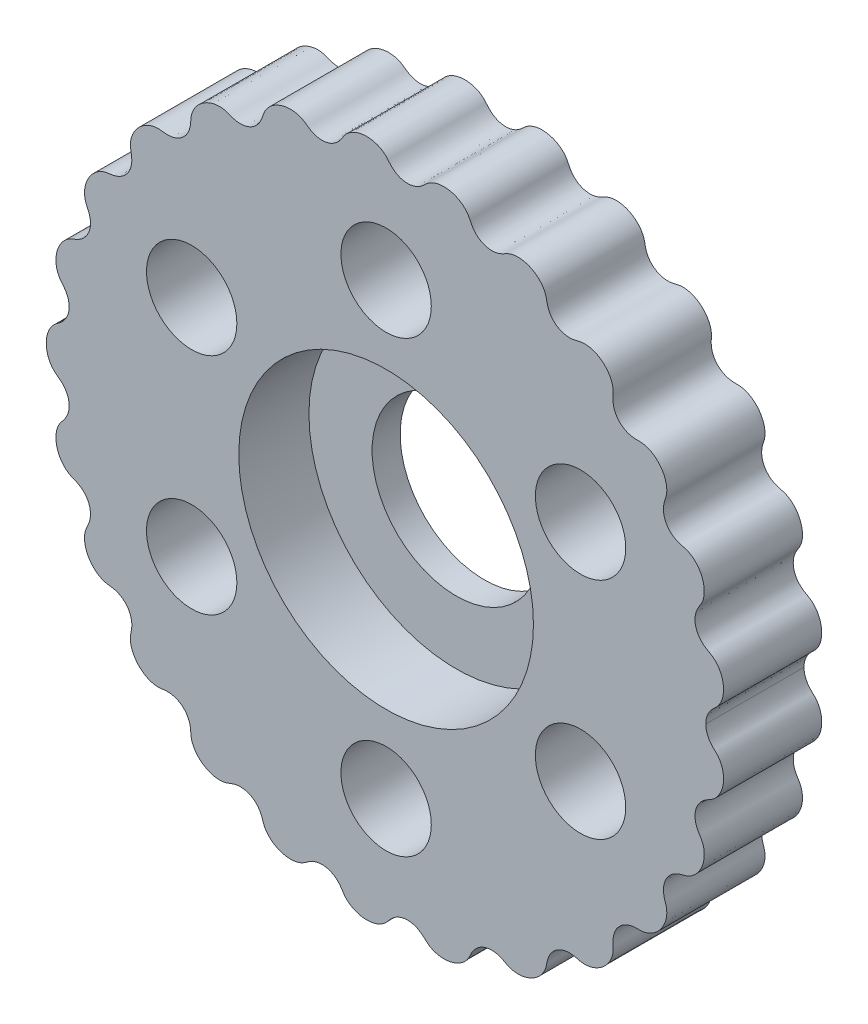
from build123d import *

# Parameters (mm, degrees)
BOSS_EXTRUDE2_OUTLINE_R   = 3.22
BOSS_EXTRUDE2_OUTLINE_R_2 = 6
BOSS_EXTRUDE2_DEPTH       = 7
SKETCH3_R                 = 10.5
CUT_EXTRUDE1_DEPTH        = 5


# Read off the part's stored shape, not the designer's step: Boss-Extrude2
with BuildPart() as part:
    # Boss-Extrude2 outline → Boss-Extrude2 (new body)
    with BuildSketch(Plane.XY):
        with BuildLine():
            add(Edge.make_bspline(
                [(-24.22, 0), (-24.22, -0.018549196), (-24.219447299, -0.055631093), (-24.216960054, -0.12081441), (-24.210325897, -0.213487932), (-24.197882321, -0.323999799), (-24.176299834, -0.448982193), (-24.141395786, -0.595895603), (-24.088097077, -0.760122302), (-24.021284653, -0.918911553), (-23.94083921, -1.071476253), (-23.850156372, -1.210449232), (-23.750782771, -1.335175792), (-23.644418658, -1.445156499), (-23.532877519, -1.540026346), (-23.414565779, -1.626138769), (-23.295742191, -1.711436542), (-23.152646986, -1.82541348), (-22.967845238, -2.00358463), (-22.770766979, -2.270831102), (-22.61467742, -2.646713727), (-22.562902109, -3.087016939), (-22.626971537, -3.487565417), (-22.754815757, -3.791453025), (-22.891097081, -4.006933416), (-23.001901076, -4.151043768), (-23.095543837, -4.262219923), (-23.187445569, -4.374975056), (-23.269946813, -4.494784084), (-23.406247867, -4.740164684), (-23.53300629, -5.139768536), (-23.561700117, -5.698191268), (-23.386758438, -6.370571851), (-23.08963931, -6.844663095), (-22.783232826, -7.131342999), (-22.513168869, -7.298248762), (-22.313162523, -7.386218135), (-22.073134472, -7.471500821), (-21.778048031, -7.628259898), (-21.485035026, -7.865958292), (-21.237485622, -8.200285268), (-21.080759868, -8.62358006), (-21.049802486, -9.030968373), (-21.10243357, -9.354111964), (-21.183212319, -9.594182109), (-21.255573883, -9.75945739), (-21.318445407, -9.889381057), (-21.377949252, -10.020968458), (-21.426108106, -10.157164339), (-21.493710602, -10.427539308), (-21.513763193, -10.843420478), (-21.399915455, -11.390295219), (-21.102267605, -11.921886845), (-20.739385996, -12.297765819), (-20.415144238, -12.507692145), (-20.187923445, -12.608393522), (-19.997598517, -12.663680464), (-19.851881049, -12.690844938), (-19.704782383, -12.708389621), (-19.557874768, -12.727166257), (-19.375798661, -12.761217219), (-19.12514698, -12.834376848), (-18.821392565, -12.983928801), (-18.504883804, -13.253142477), (-18.255677763, -13.631335911), (-18.133312589, -14.023313646), (-18.110968987, -14.38890418), (-18.150097941, -14.710357198), (-18.216222015, -14.985193283), (-18.236712715, -15.281724635), (-18.197714574, -15.589639034), (-18.079407169, -15.979423518), (-17.869747332, -16.35091051), (-17.588251709, -16.675151517), (-17.245174502, -16.936765712), (-16.93557318, -17.10184519), (-16.649505418, -17.195443205), (-16.402439494, -17.234569713), (-16.203020578, -17.238662266), (-16.054339482, -17.227081449), (-15.906658236, -17.206886615), (-15.75867165, -17.189257805), (-15.572570565, -17.178637046), (-15.309989239, -17.1903718), (-14.977339407, -17.264917246), (-14.609384419, -17.451766877), (-14.284470124, -17.754814286), (-14.075231513, -18.097537161), (-13.964820751, -18.437303989), (-13.921748971, -18.754956982), (-13.917697603, -19.039689384), (-13.864404565, -19.334240426), (-13.749434711, -19.624864832), (-13.536523355, -19.975209385), (-13.240132232, -20.282910695), (-12.88771773, -20.525640252), (-12.493535044, -20.692228457), (-12.158712678, -20.774525308), (-11.862323107, -20.795520407), (-11.614686672, -20.774204172), (-11.419415062, -20.730290527), (-11.275199236, -20.682153953), (-11.134451159, -20.624861714), (-10.992971305, -20.569653368), (-10.811872967, -20.511706104), (-10.549107659, -20.456700486), (-10.199715261, -20.447491826), (-9.687556794, -20.567355209), (-9.25037612, -20.866339464), (-8.968827339, -21.252640531), (-8.814695671, -21.647404154), (-8.739465668, -21.920231231), (-8.611721283, -22.188801487), (-8.42738688, -22.438434035), (-8.133949594, -22.720870574), (-7.770071853, -22.943127422), (-7.366221207, -23.089260936), (-6.939032338, -23.150661023), (-6.587869488, -23.143846389), (-6.292381178, -23.085836661), (-6.057739899, -22.999115679), (-5.882069033, -22.905084999), (-5.758332763, -22.822538888), (-5.639078076, -22.733742645), (-5.517851091, -22.64774948), (-5.359585734, -22.549960212), (-5.118319749, -22.433035532), (-4.778223472, -22.33872334), (-4.244654046, -22.333064891), (-3.743968072, -22.525473928), (-3.380994126, -22.837472428), (-3.141942745, -23.180994421), (-3.005014863, -23.416642838), (-2.817421884, -23.63777599), (-2.580133042, -23.830851932), (-2.225963667, -24.030840774), (-1.747814609, -24.176595657), (-1.251961822, -24.202098476), (-0.771687178, -24.109125397), (-0.414489924, -23.958870166), (-0.161771104, -23.800119537), (0.050781503, -23.604208696), (0.218769388, -23.382667303), (0.498394334, -23.077063686), (0.893761638, -22.818281334), (1.407028151, -22.690961221), (1.92871029, -22.758151519), (2.256288171, -22.892453356), (2.482604783, -23.037782528), (2.628380604, -23.154295335), (2.738552876, -23.254753519), (2.845991601, -23.358186274), (2.958265856, -23.456441637), (3.120637218, -23.57299944), (3.342765564, -23.689815649), (3.629235302, -23.785703254), (3.977788991, -23.837563944), (4.409572456, -23.831034145), (4.82850544, -23.737573531), (5.216871718, -23.563921395), (5.543216012, -23.32245651), (5.757454793, -23.099530667), (5.919135345, -22.850999627), (6.02803793, -22.590749943), (6.22752105, -22.218605364), (6.553636474, -21.867329577), (7.02701751, -21.620425793), (7.552862402, -21.563982853), (7.900603849, -21.617256944), (8.1533003, -21.704275106), (8.321673277, -21.782033314), (8.452093648, -21.852347996), (8.581218988, -21.925143682), (8.714257717, -21.990651868), (8.90013323, -22.060683045), (9.14324341, -22.116039199), (9.442774436, -22.135445704), (9.790757825, -22.09739811), (10.206403733, -21.982191318), (10.588566468, -21.785708941), (10.921886357, -21.518268586), (11.177280688, -21.199328893), (11.3283947, -20.92698625), (11.419718838, -20.642985442), (11.459957802, -20.36193621), (11.566210556, -19.950075147), (11.799506653, -19.534359487), (12.194871241, -19.188375758), (12.68284706, -19.008667979), (13.023551629, -18.973847007), (13.286272703, -18.993605261), (13.470452069, -19.026687065), (13.615581608, -19.062393068), (13.759984567, -19.101224633), (13.906334643, -19.132197796), (14.105203931, -19.154274515), (14.356070472, -19.147504215), (14.652753438, -19.091339465), (14.981996718, -18.966817291), (15.353938748, -18.751955375), (15.672102472, -18.468978027), (15.925298997, -18.132406826), (16.093701913, -17.765521967), (16.174698894, -17.464991063), (16.195684783, -17.164174487), (16.163741926, -16.875740052), (16.163866972, -16.439881276), (16.291933693, -15.971398633), (16.598237157, -15.536522354), (17.034118674, -15.246088087), (17.354914106, -15.132998624), (17.613128579, -15.090218079), (17.798685621, -15.078314396), (17.947201674, -15.077706652), (18.095803014, -15.079006435), (18.244270559, -15.071093086), (18.440809704, -15.04107354), (18.679957605, -14.970443081), (18.950666989, -14.841236608), (19.235747663, -14.638525928), (19.543341384, -14.33470779), (19.8297987, -13.903911803), (19.983392332, -13.460501992), (20.017116459, -13.04696509), (19.985514577, -12.771061032), (19.955755619, -12.630218549), (19.913960824, -12.492520105), (19.867963993, -12.356265596), (19.81636544, -12.184030592), (19.76503016, -11.936940375), (19.750952131, -11.610801976), (19.829317521, -11.210537287), (20.034424804, -10.807989124), (20.320092443, -10.504847824), (20.609079397, -10.321805943), (20.85053307, -10.221856799), (21.024916919, -10.168328263), (21.166343012, -10.132703829), (21.307719173, -10.096549746), (21.446063213, -10.050068884), (21.703324104, -9.935007107), (22.045286112, -9.68904697), (22.401149752, -9.256576328), (22.660312503, -8.611717803), (22.703211517, -8.055135884), (22.629379774, -7.643875175), (22.526663265, -7.383733999), (22.460820885, -7.254575689), (22.384514656, -7.131346994), (22.30568153, -7.009834555), (22.213474652, -6.853938548), (22.10426648, -6.62451199), (22.013504565, -6.30870382), (21.996622733, -5.900127508), (22.102695807, -5.461383578), (22.309115562, -5.101414432), (22.545297228, -4.857298063), (22.754708048, -4.703878072), (22.910181412, -4.610573065), (23.037791561, -4.541742013), (23.164559665, -4.471195967), (23.285394077, -4.390851405), (23.50265665, -4.214216807), (23.768396846, -3.891074365), (24.002258872, -3.383866348), (24.079073491, -2.780895787), (24.012242541, -2.266002194), (23.880082348, -1.907843823), (23.760883417, -1.693318548), (23.6444806, -1.536244882), (23.546636266, -1.427917722), (23.440687726, -1.327636726), (23.333658759, -1.228607564), (23.205809889, -1.098580734), (23.078843694, -0.942768192), (22.977013553, -0.779743996), (22.900316676, -0.614098088), (22.854234188, -0.484795208), (22.824468983, -0.379786311), (22.801987234, -0.2744556), (22.786924397, -0.161897379), (22.781258991, -0.070575409), (22.78, -0.023577675), (22.78, 0)],
                knots=[0.069077773, 0.069077773, 0.069077773, 0.069077773, 0.069077773, 0.069947722, 0.070817672, 0.071687622, 0.072557572, 0.074297471, 0.076037371, 0.07777727, 0.07951717, 0.081257069, 0.082996969, 0.084474896, 0.085952824, 0.087430751, 0.088908678, 0.090386606, 0.091864533, 0.094820388, 0.09925974, 0.103699091, 0.108105886, 0.11251268, 0.115450198, 0.116918956, 0.118387715, 0.119856473, 0.121325232, 0.122793991, 0.124262749, 0.131176704, 0.138090659, 0.145012312, 0.151933966, 0.153403354, 0.154872742, 0.157811519, 0.160750295, 0.163689072, 0.168315415, 0.172941758, 0.177322078, 0.181702397, 0.184618838, 0.186077059, 0.187535279, 0.1889935, 0.19045172, 0.191909941, 0.193368161, 0.200235942, 0.207103723, 0.214117898, 0.217624986, 0.221132074, 0.222628415, 0.224124756, 0.225621096, 0.227117437, 0.228613778, 0.230110118, 0.2331028, 0.237643376, 0.242183952, 0.246677516, 0.25117108, 0.254023146, 0.256875212, 0.259727278, 0.262579345, 0.265963706, 0.269348067, 0.276116788, 0.279646578, 0.283176367, 0.286706156, 0.290235945, 0.291741606, 0.293247267, 0.294752928, 0.296258589, 0.29776425, 0.29926991, 0.302281232, 0.306853324, 0.311425416, 0.315720291, 0.320015165, 0.322888365, 0.325761565, 0.328634765, 0.331507964, 0.334913392, 0.33831882, 0.345129676, 0.348598999, 0.352068322, 0.355537646, 0.359006969, 0.360541804, 0.36207664, 0.363611475, 0.365146311, 0.366681146, 0.368215982, 0.371285653, 0.375975692, 0.380665732, 0.389194987, 0.392049231, 0.394903475, 0.397757719, 0.400611963, 0.403994631, 0.4073773, 0.414142636, 0.417675708, 0.42120878, 0.424741852, 0.428274924, 0.429776811, 0.431278698, 0.432780586, 0.434282473, 0.43578436, 0.437286247, 0.440290022, 0.445097402, 0.449904782, 0.458550476, 0.461299252, 0.464048029, 0.466796805, 0.469545582, 0.472948127, 0.476350673, 0.483155764, 0.489551347, 0.492749139, 0.49594693, 0.49875113, 0.50155533, 0.50435953, 0.50716373, 0.515462993, 0.520285406, 0.525107819, 0.528120865, 0.529627388, 0.531133911, 0.532640434, 0.534146957, 0.53565348, 0.537160003, 0.540704391, 0.544248779, 0.547793167, 0.551337555, 0.558080044, 0.561451288, 0.564822533, 0.567667546, 0.570512559, 0.573357571, 0.576202584, 0.584701263, 0.589493508, 0.594285754, 0.597280306, 0.598777582, 0.600274859, 0.601772135, 0.603269411, 0.604766687, 0.606263964, 0.60978562, 0.613307276, 0.616828933, 0.620350589, 0.627138717, 0.630532782, 0.633926846, 0.636790488, 0.639654129, 0.642517771, 0.645381413, 0.653941022, 0.658528672, 0.663116322, 0.666137122, 0.667647521, 0.669157921, 0.670668321, 0.672178721, 0.67368912, 0.67519952, 0.678740508, 0.682281496, 0.685822484, 0.689363472, 0.696022465, 0.699351962, 0.702681458, 0.705607729, 0.708534, 0.711460271, 0.714386541, 0.723181903, 0.727738304, 0.732294704, 0.735296652, 0.736797625, 0.738298599, 0.739799573, 0.741300546, 0.74280152, 0.744302494, 0.747820982, 0.75133947, 0.754857958, 0.758376445, 0.765220964, 0.772065482, 0.773518459, 0.774971437, 0.776424414, 0.777877391, 0.779330369, 0.780783346, 0.783689301, 0.788056529, 0.792423757, 0.797067025, 0.801710293, 0.804657596, 0.806131247, 0.807604899, 0.80907855, 0.810552202, 0.812025854, 0.813499505, 0.820444506, 0.827389507, 0.834280436, 0.841171366, 0.842634884, 0.844098403, 0.845561921, 0.84702544, 0.848488958, 0.849952477, 0.852879514, 0.857272875, 0.861666236, 0.866275507, 0.870884777, 0.873814777, 0.875279777, 0.876744777, 0.878209777, 0.879674777, 0.881139777, 0.882604777, 0.889503673, 0.896402569, 0.903339417, 0.906807841, 0.910276264, 0.911749575, 0.913222885, 0.914696195, 0.916169505, 0.917642815, 0.919116126, 0.922062746, 0.924274313, 0.925380096, 0.92648588, 0.927591663, 0.928697446, 0.92980323, 0.930909013, 0.930909013, 0.930909013, 0.930909013, 0.930909013], degree=4))
            add(Edge.make_bspline(
                [(22.78, 0), (22.78, 0.011788838), (22.780314749, 0.035502688), (22.781731106, 0.076509963), (22.785505254, 0.135473486), (22.792573008, 0.206038602), (22.804797658, 0.285774525), (22.824467981, 0.379531373), (22.854236356, 0.485170134), (22.900312372, 0.613964918), (22.977023325, 0.77979384), (23.078825905, 0.942766565), (23.205839603, 1.098545128), (23.333634687, 1.228656662), (23.440629098, 1.327686413), (23.546726131, 1.427803175), (23.644449785, 1.536290512), (23.760891492, 1.693306709), (23.880077692, 1.907847427), (24.012247527, 2.266002298), (24.079067136, 2.780891982), (24.002268665, 3.383875495), (23.768385035, 3.891060688), (23.502670102, 4.214235612), (23.285371375, 4.390811541), (23.164625106, 4.471307603), (23.037738709, 4.541696012), (22.910177975, 4.610512829), (22.754714776, 4.703915141), (22.545294502, 4.857275391), (22.309115579, 5.101431249), (22.102698357, 5.461370584), (21.996617293, 5.900139936), (22.0135147, 6.308688494), (22.104249292, 6.624533194), (22.213507781, 6.853901404), (22.305631416, 7.009901152), (22.384469105, 7.131339214), (22.460933264, 7.254513907), (22.526621015, 7.383759503), (22.629402843, 7.643861925), (22.703194156, 8.055147399), (22.660322715, 8.611706519), (22.401145561, 9.256588641), (22.045284473, 9.689032191), (21.703329043, 9.935025827), (21.446053318, 10.050027634), (21.3077535, 10.096684111), (21.166299396, 10.132606815), (21.024933481, 10.168298687), (20.850528057, 10.221884743), (20.609083858, 10.321788394), (20.320087189, 10.504860859), (20.034431347, 10.807979297), (19.829308378, 11.210546349), (19.750966778, 11.610791121), (19.765006377, 11.936955327), (19.816412166, 12.184003328), (19.867874099, 12.356324961), (19.913962066, 12.492483765), (19.955859135, 12.630196462), (19.98546863, 12.771073715), (20.017144531, 13.046959365), (19.98336635, 13.460505537), (19.829815883, 13.903910966), (19.543332796, 14.334706685), (19.23575249, 14.638528903), (18.950663354, 14.841229828), (18.679960115, 14.970452633), (18.440806166, 15.04106199), (18.244281736, 15.071073941), (18.095774528, 15.079150553), (17.947225277, 15.077555571), (17.798654784, 15.078345654), (17.613206514, 15.090201316), (17.354773585, 15.133036393), (17.034347981, 15.246022146), (16.689602504, 15.475530495), (16.399981775, 15.818415405), (16.231829046, 16.189946273), (16.164196631, 16.548844988), (16.163431333, 16.875824418), (16.1958915, 17.164119055), (16.174576447, 17.465025364), (16.093767809, 17.765502905), (15.925242709, 18.132422499), (15.672140553, 18.46896897), (15.353917234, 18.751957909), (14.982006718, 18.966819943), (14.652749423, 19.091329604), (14.356069083, 19.147520328), (14.105208051, 19.1542509), (13.906342915, 19.132201216), (13.759927431, 19.101333197), (13.615649191, 19.062246972), (13.470404068, 19.026726211), (13.286360067, 18.993601328), (13.023396743, 18.973851457), (12.683099797, 19.008661318), (12.295155061, 19.151329038), (11.937022158, 19.414364266), (11.689475746, 19.729676564), (11.540087077, 20.052846138), (11.459615283, 20.361937775), (11.419949452, 20.642984369), (11.328260174, 20.926988594), (11.177353088, 21.199326923), (10.921827252, 21.518269711), (10.588605406, 21.785709408), (10.20638271, 21.982189009), (9.790766232, 22.097402216), (9.442774074, 22.135437025), (9.143237366, 22.116051685), (8.900143935, 22.060665314), (8.714262887, 21.990650855), (8.581151286, 21.925238987), (8.452161083, 21.852217714), (8.32167887, 21.782068117), (8.153284552, 21.704269882), (7.900619324, 21.617261425), (7.552845832, 21.563977773), (7.027041632, 21.620433966), (6.553604126, 21.867317998), (6.227565458, 22.218621379), (6.027976046, 22.590728313), (5.919209729, 22.851022936), (5.75740646, 23.09951713), (5.543241097, 23.3224632), (5.21685252, 23.563915287), (4.828516316, 23.737579086), (4.409569317, 23.83102858), (3.977786072, 23.837570132), (3.629246427, 23.785692367), (3.342747509, 23.689830805), (3.120663439, 23.572976666), (2.958254225, 23.456456883), (2.845922534, 23.358239395), (2.738654298, 23.25464893), (2.628362912, 23.154337822), (2.482597715, 23.037769763), (2.256297892, 22.892463673), (1.928698001, 22.758141295), (1.407047224, 22.690975813), (0.89373513, 22.818262022), (0.49843177, 23.077089852), (0.218715244, 23.38263125), (0.050843029, 23.604245849), (-0.161813442, 23.800096965), (-0.414467111, 23.958880045), (-0.771706921, 24.109119275), (-1.251940953, 24.202101308), (-1.747836163, 24.176596922), (-2.225942084, 24.030836103), (-2.580158028, 23.830859991), (-2.817376903, 23.637757983), (-3.005078649, 23.416672029), (-3.141885623, 23.180965384), (-3.381034925, 22.837493981), (-3.743938637, 22.5254581), (-4.244675676, 22.333076498), (-4.778209021, 22.338715623), (-5.118332663, 22.433043083), (-5.359573745, 22.549950875), (-5.517845804, 22.647789338), (-5.639163503, 22.733623532), (-5.758262398, 22.82261295), (-5.882066293, 22.905093081), (-6.057759026, 22.999094605), (-6.292367392, 23.085851031), (-6.587877969, 23.143836223), (-6.93903043, 23.150666378), (-7.366217864, 23.089256815), (-7.770082111, 22.943130622), (-8.133931713, 22.720867861), (-8.427410461, 22.438436661), (-8.611674455, 22.188795287), (-8.739539913, 21.920243727), (-8.814631849, 21.64739126), (-8.968874399, 21.252650247), (-9.250341052, 20.866332727), (-9.687583596, 20.567359353), (-10.199695857, 20.447489958), (-10.549127869, 20.456701101), (-10.811849282, 20.511706452), (-10.99298852, 20.569684129), (-11.134496222, 20.624719852), (-11.275138476, 20.682279), (-11.419428546, 20.730268096), (-11.614690037, 20.774198482), (-11.862319652, 20.795525505), (-12.158714195, 20.774521643), (-12.493536544, 20.692229849), (-12.887712066, 20.525640266), (-13.240143962, 20.282908978), (-13.536504556, 19.975212759), (-13.749459069, 19.624860499), (-13.864354787, 19.334247305), (-13.917781686, 19.03968137), (-13.92166162, 18.754961956), (-13.964871074, 18.437302295), (-14.075200888, 18.097537597), (-14.284489946, 17.754814515), (-14.609371192, 17.45176603), (-14.977348186, 17.264918897), (-15.309984495, 17.190369612), (-15.572571936, 17.178639713), (-15.758667665, 17.189288363), (-15.90669389, 17.206737145), (-16.054296685, 17.227208967), (-16.20303043, 17.238654896), (-16.402440757, 17.234551233), (-16.64950379, 17.195456941), (-16.935573139, 17.101835933), (-17.245176873, 16.936769349), (-17.588245396, 16.675151123), (-17.869759461, 16.350906953), (-18.079388388, 15.979431043), (-18.197737474, 15.589629288), (-18.236665991, 15.281743064), (-18.21629975, 14.985166056), (-18.150016409, 14.710382207), (-18.111017664, 14.388890655), (-18.133282219, 14.023320939), (-18.255697504, 13.631332539), (-18.504870705, 13.253142734), (-18.821401423, 12.98393189), (-19.125141907, 12.834370113), (-19.375800435, 12.761229426), (-19.557879876, 12.727175092), (-19.704776023, 12.708249977), (-19.851874552, 12.690997222), (-19.997605245, 12.663652709), (-20.187921244, 12.608387467), (-20.415143068, 12.507697755), (-20.739390283, 12.297760201), (-21.102259264, 11.921892433), (-21.399930819, 11.39028823), (-21.513742764, 10.843428092), (-21.493735534, 10.427529854), (-21.426064186, 10.157183317), (-21.378058016, 10.020927967), (-21.318422074, 9.889353063), (-21.255505749, 9.759532902), (-21.183245449, 9.5941251), (-21.102426037, 9.35417193), (-21.049792643, 9.030886154), (-21.080786144, 8.623693714), (-21.237438134, 8.200115183), (-21.48511436, 7.866222761), (-21.749480491, 7.650981948), (-21.976502265, 7.523346987), (-22.14264464, 7.449252189), (-22.278137268, 7.396562523), (-22.413421048, 7.342927019), (-22.544052562, 7.278747251), (-22.783314369, 7.131582107), (-23.089581003, 6.844468428), (-23.386779124, 6.37069817), (-23.539861082, 5.782149579), (-23.539324421, 5.263558125), (-23.454642248, 4.892615439), (-23.364583091, 4.665177176), (-23.269940606, 4.494853195), (-23.187529867, 4.374864232), (-23.095494765, 4.262248048), (-23.001865612, 4.151101009), (-22.891124087, 4.006896815), (-22.754801609, 3.7914741), (-22.626979666, 3.487550223), (-22.562898301, 3.087028874), (-22.614678245, 2.646701775), (-22.77076921, 2.270846278), (-22.967839379, 2.003563886), (-23.152659179, 1.825448341), (-23.295735426, 1.711396374), (-23.414506334, 1.626067685), (-23.532948732, 1.540151117), (-23.644400388, 1.445115879), (-23.750777682, 1.335161776), (-23.850160104, 1.2104794), (-23.940836606, 1.071419346), (-24.021286041, 0.919026015), (-24.0880965, 0.759872545), (-24.141396004, 0.596315967), (-24.176299705, 0.448960704), (-24.197882444, 0.322007353), (-24.210326134, 0.216806144), (-24.216958264, 0.124082101), (-24.219447309, 0.056324213), (-24.22, 0.018549195), (-24.22, 0)],
                knots=[0.069090958, 0.069090958, 0.069090958, 0.069090958, 0.069090958, 0.06964385, 0.070196742, 0.070749633, 0.071302525, 0.072408309, 0.073514092, 0.074619875, 0.075725659, 0.077937226, 0.080883846, 0.082357156, 0.083830467, 0.085303777, 0.086777087, 0.088250397, 0.089723708, 0.093192132, 0.096660555, 0.103597403, 0.1104963, 0.117395196, 0.118860196, 0.120325196, 0.121790196, 0.123255196, 0.124720196, 0.126185196, 0.129115196, 0.133724467, 0.138333738, 0.142727099, 0.14712046, 0.150047497, 0.151511016, 0.152974534, 0.154438053, 0.155901571, 0.15736509, 0.158828608, 0.165719538, 0.172610468, 0.179555469, 0.18650047, 0.187974122, 0.189447773, 0.190921425, 0.192395076, 0.193868728, 0.195342379, 0.198289683, 0.202932951, 0.207576218, 0.211943447, 0.216310675, 0.21921663, 0.220669607, 0.222122585, 0.223575562, 0.22502854, 0.226481517, 0.227934495, 0.234779013, 0.241623531, 0.245142019, 0.248660507, 0.252178995, 0.255697483, 0.257198457, 0.258699431, 0.260200405, 0.261701378, 0.263202352, 0.264703326, 0.267705273, 0.272261674, 0.276818074, 0.281215756, 0.285613437, 0.288539708, 0.291465978, 0.294392249, 0.29731852, 0.300648017, 0.303977513, 0.310636507, 0.314177495, 0.317718483, 0.321259471, 0.324800459, 0.326310859, 0.327821259, 0.329331659, 0.330842058, 0.332352458, 0.333862858, 0.336883658, 0.341471308, 0.346058958, 0.350338763, 0.354618567, 0.357482209, 0.360345851, 0.363209493, 0.366073135, 0.369467199, 0.372861263, 0.379649392, 0.383171048, 0.386692705, 0.390214361, 0.393736018, 0.395233294, 0.39673057, 0.398227847, 0.399725123, 0.401222399, 0.402719676, 0.405714228, 0.410506473, 0.415298719, 0.423797398, 0.426642411, 0.429487424, 0.432332437, 0.43517745, 0.438548695, 0.441919939, 0.448662429, 0.452206817, 0.455751205, 0.459295593, 0.462839981, 0.464346504, 0.465853027, 0.46735955, 0.468866073, 0.470372596, 0.471879119, 0.474892165, 0.479714578, 0.484536991, 0.492836254, 0.495640454, 0.498444654, 0.501248854, 0.504053054, 0.507250846, 0.510448638, 0.516844221, 0.523649313, 0.527051858, 0.530454404, 0.53320318, 0.535951957, 0.538700734, 0.54144951, 0.550095204, 0.554902584, 0.559709965, 0.562713739, 0.564215627, 0.565717514, 0.567219401, 0.568721288, 0.570223176, 0.571725063, 0.575258135, 0.578791207, 0.582324279, 0.585857351, 0.592622688, 0.596005356, 0.599388024, 0.602242268, 0.605096512, 0.607950757, 0.610805001, 0.619334256, 0.624024296, 0.628714336, 0.631784007, 0.633318842, 0.634853678, 0.636388513, 0.637923349, 0.639458184, 0.64099302, 0.644462343, 0.647931667, 0.65140099, 0.654870314, 0.66168117, 0.665086598, 0.668492025, 0.671365225, 0.674238425, 0.677111625, 0.679984825, 0.6842797, 0.688574574, 0.693146667, 0.697718759, 0.70073008, 0.702235741, 0.703741402, 0.705247063, 0.706752724, 0.708258385, 0.709764046, 0.713293835, 0.716823624, 0.720353414, 0.723883203, 0.730651925, 0.734036286, 0.737420647, 0.740272714, 0.74312478, 0.745976846, 0.748828913, 0.753322476, 0.75781604, 0.762356617, 0.766897193, 0.769889875, 0.771386215, 0.772882556, 0.774378897, 0.775875237, 0.777371578, 0.778867919, 0.782375007, 0.785882095, 0.792896271, 0.799764052, 0.806631833, 0.808090053, 0.809548274, 0.811006494, 0.812464715, 0.813922935, 0.815381156, 0.818297597, 0.822677917, 0.827058237, 0.83168458, 0.836310923, 0.8392497, 0.840719088, 0.842188477, 0.843657865, 0.845127253, 0.846596642, 0.84806603, 0.854987683, 0.861909337, 0.868823292, 0.872280269, 0.875737247, 0.877206006, 0.878674764, 0.880143523, 0.881612282, 0.88308104, 0.884549799, 0.887487316, 0.891894111, 0.896300906, 0.900740257, 0.905179609, 0.908135464, 0.909613391, 0.911091319, 0.912569246, 0.914047174, 0.915525101, 0.917003029, 0.918742928, 0.920482828, 0.922222727, 0.923962627, 0.925702526, 0.927442426, 0.928312376, 0.929182326, 0.930052275, 0.930922225, 0.930922225, 0.930922225, 0.930922225, 0.930922225], degree=4))
        make_face()
        with Locations((-13.856406461, -8)):
            Circle(BOSS_EXTRUDE2_OUTLINE_R, mode=Mode.SUBTRACT)
        with Locations((0, -16)):
            Circle(BOSS_EXTRUDE2_OUTLINE_R, mode=Mode.SUBTRACT)
        Circle(BOSS_EXTRUDE2_OUTLINE_R_2, mode=Mode.SUBTRACT)
        with Locations((13.856406461, -8)):
            Circle(BOSS_EXTRUDE2_OUTLINE_R, mode=Mode.SUBTRACT)
        with Locations((-13.856406461, 8)):
            Circle(BOSS_EXTRUDE2_OUTLINE_R, mode=Mode.SUBTRACT)
        with Locations((13.856406461, 8)):
            Circle(BOSS_EXTRUDE2_OUTLINE_R, mode=Mode.SUBTRACT)
        with Locations((0, 16)):
            Circle(BOSS_EXTRUDE2_OUTLINE_R, mode=Mode.SUBTRACT)
    extrude(amount=BOSS_EXTRUDE2_DEPTH)

    # Sketch3 → Cut-Extrude1 (cut)
    with BuildSketch(Plane.XY.offset(7)):
        Circle(SKETCH3_R)
    extrude(amount=-CUT_EXTRUDE1_DEPTH, mode=Mode.SUBTRACT)


solid = part.part
